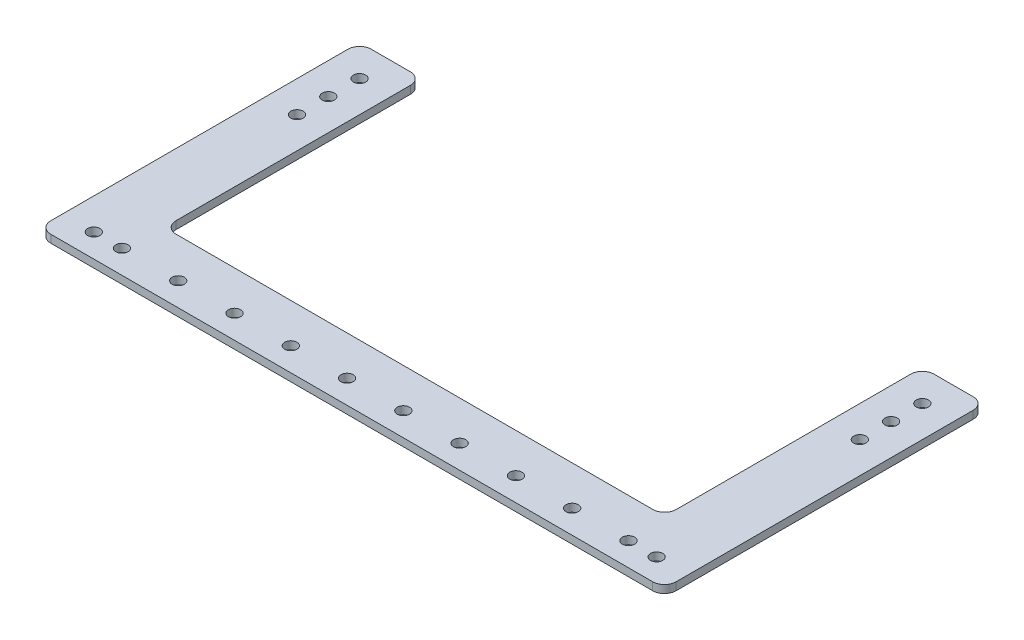
from build123d import *

# Parameters (mm, degrees)
SKETCH2_R           = 2.4892
BOSS_EXTRUDE1_DEPTH = 3.175
FILLET1_R           = 4.7625
SKETCH3_R           = 2.4892
CUT_EXTRUDE1_DEPTH  = 143.74264703


with BuildPart() as part:
    # Sketch2 → Boss-Extrude1 (new body)
    with BuildSketch(Plane(origin=(0, 0, 0), x_dir=(1, 0, 0), z_dir=(0, 1, 0))):
        Polygon((-127, 65.0875), (-127, -65.0875), (127, -65.0875), (127, 65.0875), (101.6, 65.0875), (101.6, -39.624), (-101.6, -39.624), (-101.6, 65.0875), align=None)
        with Locations((-114.3, 26.9875)):
            Circle(SKETCH2_R, mode=Mode.SUBTRACT)
        with Locations((-114.3, 39.6875)):
            Circle(SKETCH2_R, mode=Mode.SUBTRACT)
        with Locations((-114.3, 52.3875)):
            Circle(SKETCH2_R, mode=Mode.SUBTRACT)
        with Locations((114.3, 26.9875)):
            Circle(SKETCH2_R, mode=Mode.SUBTRACT)
        with Locations((114.3, 39.6875)):
            Circle(SKETCH2_R, mode=Mode.SUBTRACT)
        with Locations((114.3, 52.3875)):
            Circle(SKETCH2_R, mode=Mode.SUBTRACT)
    extrude(amount=BOSS_EXTRUDE1_DEPTH)

    # Fillet1
    fillet1_edges = [part.edges().sort_by_distance(p)[0] for p in [
        (127, 1.5875, -65.0875),
        (-127, 1.5875, 65.0875),
        (-127, 1.5875, -65.0875),
        (-101.6, 1.5875, -65.0875),
        (-101.6, 1.5875, 39.624),
        (101.6, 1.5875, 39.624),
        (101.6, 1.5875, -65.0875),
        (127, 1.5875, 65.0875),
    ]]
    fillet(fillet1_edges, radius=FILLET1_R)

    # Sketch3 → Cut-Extrude1 (cut, through all)
    with BuildSketch(Plane(origin=(0, 3.175, 0), x_dir=(1, 0, 0), z_dir=(0, 1, 0))):
        with Locations((-102.87, -55.5625)):
            Circle(SKETCH3_R)
        with Locations((-80.01, -55.5625)):
            Circle(SKETCH3_R)
        with Locations((-114.3, -55.5625)):
            Circle(SKETCH3_R)
        with Locations((-57.15, -55.5625)):
            Circle(SKETCH3_R)
        with Locations((114.3, -55.5625)):
            Circle(SKETCH3_R)
        with Locations((-34.29, -55.5625)):
            Circle(SKETCH3_R)
        with Locations((-11.43, -55.5625)):
            Circle(SKETCH3_R)
        with Locations((11.43, -55.5625)):
            Circle(SKETCH3_R)
        with Locations((34.29, -55.5625)):
            Circle(SKETCH3_R)
        with Locations((57.15, -55.5625)):
            Circle(SKETCH3_R)
        with Locations((80.01, -55.5625)):
            Circle(SKETCH3_R)
        with Locations((102.87, -55.5625)):
            Circle(SKETCH3_R)
    extrude(amount=-CUT_EXTRUDE1_DEPTH, mode=Mode.SUBTRACT)


solid = part.part
